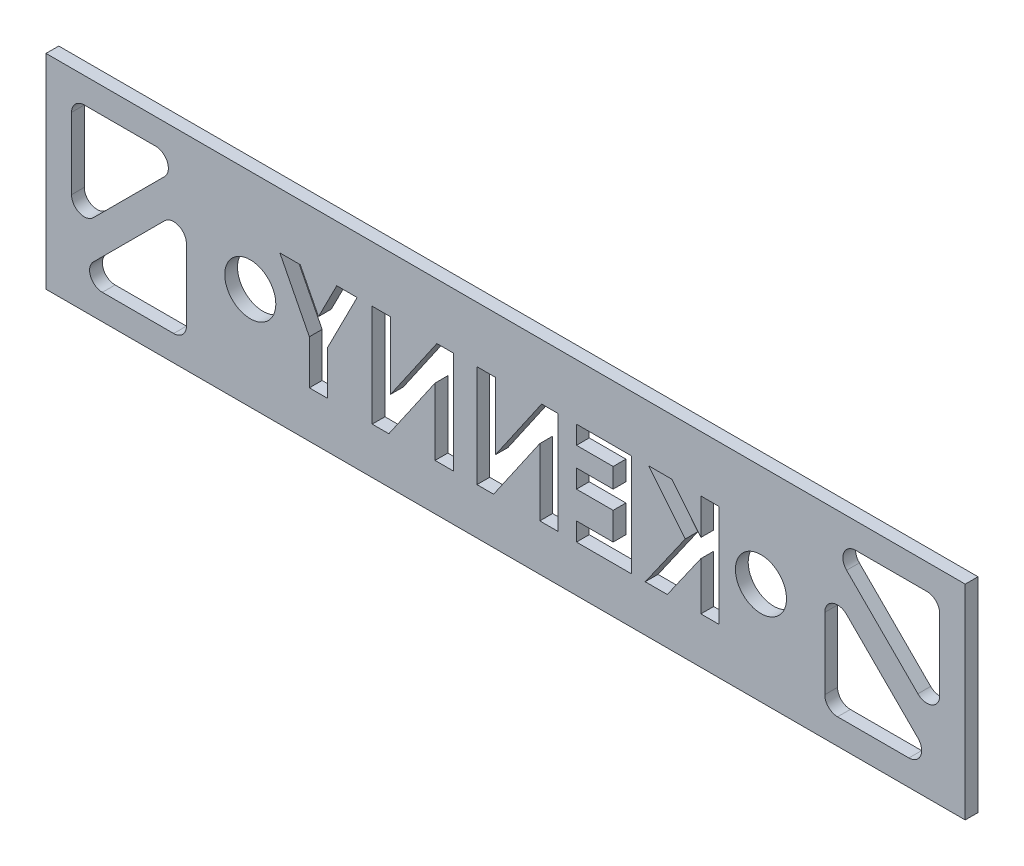
from build123d import *

# Parameters (mm, degrees)
SKETCH1_W           = 6.35
SKETCH1_H           = 101.6
BOSS_EXTRUDE1_DEPTH = 457.2
SKETCH2_R           = 12.7
CUT_EXTRUDE1_DEPTH  = 467.602190566
CUT_EXTRUDE2_DEPTH  = 467.602190566


with BuildPart() as part:
    # Sketch1 → Boss-Extrude1 (new body)
    with BuildSketch(Plane(origin=(0, 0, 0), x_dir=(0, 0, -1), z_dir=(1, 0, 0))):
        with Locations((1.913371748, -42.180867605)):
            Rectangle(SKETCH1_W, SKETCH1_H)
    extrude(amount=BOSS_EXTRUDE1_DEPTH)

    # Sketch2 → Cut-Extrude1 (cut, through all)
    with BuildSketch(Plane(origin=(0, 0, -5.088371748), x_dir=(-1, 0, 0), z_dir=(0, 0, -1))):
        with Locations((-355.6, -42.180867605)):
            Circle(SKETCH2_R)
        with Locations((-101.6, -42.180867605)):
            Circle(SKETCH2_R)
    extrude(amount=-CUT_EXTRUDE1_DEPTH, mode=Mode.SUBTRACT)

    # Sketch3 → Cut-Extrude2 (cut, through all)
    with BuildSketch(Plane(origin=(0, 0, -5.088371748), x_dir=(-1, 0, 0), z_dir=(0, 0, -1))):
        with BuildLine():
            Line((-438.15, -4.080867605), (-402.680256121, -4.080867605))
            ThreePointArc((-402.680256121, -4.080867605), (-396.81362109, -8.000827809), (-398.190128061, -14.920995665))
            Line((-398.190128061, -14.920995665), (-433.659871939, -50.390739544))
            ThreePointArc((-433.659871939, -50.390739544), (-440.580039796, -51.767246515), (-444.5, -45.900611484))
            Line((-444.5, -45.900611484), (-444.5, -10.430867605))
            ThreePointArc((-444.5, -10.430867605), (-442.640128061, -5.940739544), (-438.15, -4.080867605))
        make_face()
        with BuildLine():
            Line((-398.190128061, -33.970995665), (-433.659871939, -69.440739544))
            ThreePointArc((-433.659871939, -69.440739544), (-435.03637891, -76.3609074), (-429.169743879, -80.280867605))
            Line((-429.169743879, -80.280867605), (-393.7, -80.280867605))
            ThreePointArc((-393.7, -80.280867605), (-389.209871939, -78.420995665), (-387.35, -73.930867605))
            Line((-387.35, -73.930867605), (-387.35, -38.461123726))
            ThreePointArc((-387.35, -38.461123726), (-391.269960204, -32.594488694), (-398.190128061, -33.970995665))
        make_face()
        with BuildLine():
            Line((-69.85, -73.930867605), (-69.85, -38.461123726))
            ThreePointArc((-69.85, -38.461123726), (-65.930039796, -32.594488694), (-59.009871939, -33.970995665))
            Line((-59.009871939, -33.970995665), (-23.540128061, -69.440739544))
            ThreePointArc((-23.540128061, -69.440739544), (-22.16362109, -76.3609074), (-28.030256121, -80.280867605))
            Line((-28.030256121, -80.280867605), (-63.5, -80.280867605))
            ThreePointArc((-63.5, -80.280867605), (-67.990128061, -78.420995665), (-69.85, -73.930867605))
        make_face()
        with BuildLine():
            Line((-23.540128061, -50.390739544), (-59.009871939, -14.920995665))
            ThreePointArc((-59.009871939, -14.920995665), (-60.38637891, -8.000827809), (-54.519743879, -4.080867605))
            Line((-54.519743879, -4.080867605), (-19.05, -4.080867605))
            ThreePointArc((-19.05, -4.080867605), (-14.559871939, -5.940739544), (-12.7, -10.430867605))
            Line((-12.7, -10.430867605), (-12.7, -45.900611484))
            ThreePointArc((-12.7, -45.900611484), (-16.619960204, -51.767246515), (-23.540128061, -50.390739544))
        make_face()
        Polygon((-334.83529032, -19.152522245), (-325.717341602, -19.152522245), (-325.717341602, -37.032249809), (-311.307726217, -19.152522245), (-299.798351217, -19.152522245), (-317.901956986, -41.621753014), (-298.037854422, -69.952522245), (-309.018062756, -69.952522245), (-325.717341602, -46.129845963), (-325.717341602, -69.952522245), (-334.83529032, -69.952522245), align=None)
        Polygon((-291.199392884, -19.152522245), (-263.84554673, -19.152522245), (-263.84554673, -28.270470963), (-282.081444166, -28.270470963), (-282.081444166, -38.039701732), (-263.84554673, -38.039701732), (-263.84554673, -47.15765045), (-282.081444166, -47.15765045), (-282.081444166, -60.834573527), (-263.84554673, -60.834573527), (-263.84554673, -69.952522245), (-291.199392884, -69.952522245), align=None)
        Polygon((-254.727598012, -19.152522245), (-246.515338397, -19.152522245), (-223.46605955, -52.581608783), (-223.46605955, -19.152522245), (-214.348110832, -19.152522245), (-214.348110832, -69.952522245), (-222.62142814, -69.952522245), (-245.609649294, -36.625198527), (-245.609649294, -69.952522245), (-254.727598012, -69.952522245), align=None)
        Polygon((-202.625033909, -19.152522245), (-194.412774294, -19.152522245), (-171.363495448, -52.581608783), (-171.363495448, -19.152522245), (-162.24554673, -19.152522245), (-162.24554673, -69.952522245), (-170.518864038, -69.952522245), (-193.507085191, -36.625198527), (-193.507085191, -69.952522245), (-202.625033909, -69.952522245), align=None)
        Polygon((-154.75580314, -19.152522245), (-144.610049935, -19.152522245), (-135.542982627, -36.971192117), (-126.47591532, -19.152522245), (-116.330162115, -19.152522245), (-130.984008268, -47.95140045), (-130.984008268, -69.952522245), (-140.101956986, -69.952522245), (-140.101956986, -47.95140045), align=None)
    extrude(amount=-CUT_EXTRUDE2_DEPTH, mode=Mode.SUBTRACT)


solid = part.part
